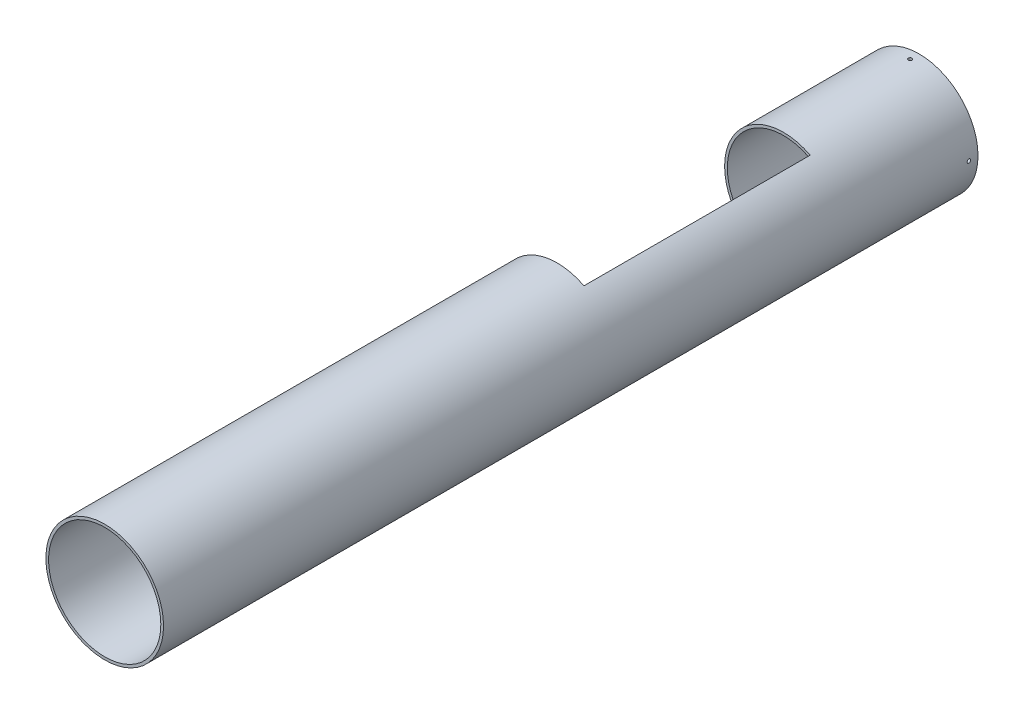
from build123d import *

# Parameters (mm, degrees)
SKETCH1_R           = 65
SKETCH1_R_2         = 62
BOSS_EXTRUDE1_DEPTH = 900
SKETCH4_W           = 130
SKETCH4_H           = 250
CUT_EXTRUDE4_DEPTH  = 516
SKETCH5_R           = 2
CUT_EXTRUDE5_DEPTH  = 85
CIRPATTERN1_COUNT   = 4


with BuildPart() as part:
    # Sketch1 → Boss-Extrude1 (new body)
    with BuildSketch(Plane.XY):
        Circle(SKETCH1_R)
        Circle(SKETCH1_R_2, mode=Mode.SUBTRACT)
    extrude(amount=BOSS_EXTRUDE1_DEPTH)

    # Sketch4 → Cut-Extrude4 (cut)
    with BuildSketch(Plane(origin=(-14.142135624, 14.142135624, 0), x_dir=(0.7071067811865477, 0.7071067811865475, 0), z_dir=(-0.7071067811865475, 0.7071067811865477, 0))):
        with Locations((0, -275)):
            Rectangle(SKETCH4_W, SKETCH4_H)
    extrude(amount=CUT_EXTRUDE4_DEPTH, mode=Mode.SUBTRACT)

    # Sketch5 → Cut-Extrude5 (cut)
    with BuildSketch(Plane(origin=(0, 0, 0), x_dir=(1, 0, 0), z_dir=(0, 1, 0))):
        with Locations((0, -10)):
            Circle(SKETCH5_R)
    cut_extrude5 = extrude(amount=-CUT_EXTRUDE5_DEPTH, mode=Mode.SUBTRACT)

    # CirPattern1: Cut-Extrude5 ×4 about axis
    cirpattern1_axis = Axis((0, 0, 900), (0, 0, -1))
    for i in range(1, CIRPATTERN1_COUNT):
        add(cut_extrude5.rotate(cirpattern1_axis, i * 360 / CIRPATTERN1_COUNT), mode=Mode.SUBTRACT)


solid = part.part
